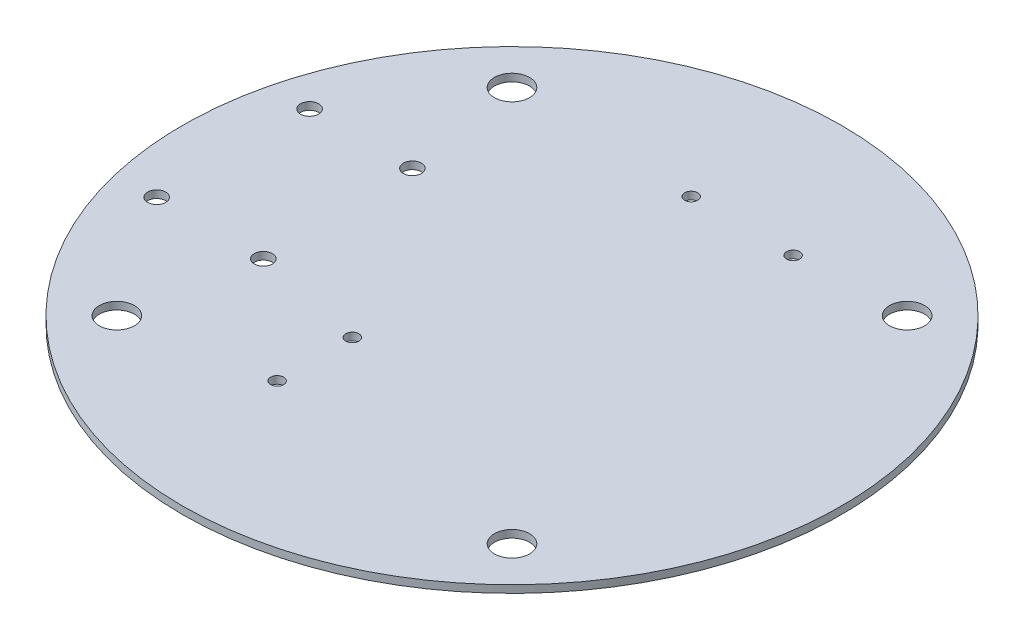
from build123d import *

# Parameters (mm, degrees)
SKETCH1_R            = 65.7
BOSS_EXTRUDE1_DEPTH  = 1.5
M6_CLEARANCE_HOLE1_D = 7
CIRPATTERN1_COUNT    = 4
M2_CLEARANCE_HOLE1_D = 2.6
M3_CLEARANCE_HOLE2_D = 3.6


with BuildPart() as part:
    # Sketch1 → Boss-Extrude1 (new body)
    with BuildSketch(Plane(origin=(0, 0, 0), x_dir=(1, 0, 0), z_dir=(0, 1, 0))):
        Circle(SKETCH1_R)
    extrude(amount=BOSS_EXTRUDE1_DEPTH)

    # M6 Clearance Hole1 (through all)
    with Locations(Plane(origin=(0, 1.5, 0), x_dir=(1, 0, 0), z_dir=(0, 1, 0))):
        with Locations((-39.385847712, -39.385847712)):
            m6_clearance_hole1 = Hole(M6_CLEARANCE_HOLE1_D / 2)

    # CirPattern1: M6 Clearance Hole1 ×4 about axis
    cirpattern1_axis = Axis((0, 1.5, 0), (0, -1, 0))
    for i in range(1, CIRPATTERN1_COUNT):
        add(m6_clearance_hole1.rotate(cirpattern1_axis, i * 360 / CIRPATTERN1_COUNT), mode=Mode.SUBTRACT)

    # M2 Clearance Hole1 (through all)
    with Locations(Plane(origin=(0, 1.5, 0), x_dir=(1, 0, 0), z_dir=(0, 1, 0))):
        with Locations((-2.709999951, 38.430000111), (17.610000128, 38.430000136), (-12.154, -19.673715678), (-12.154, -34.673715678)):
            Hole(M2_CLEARANCE_HOLE1_D / 2)

    # M3 Clearance Hole2 (through all)
    with Locations(Plane(origin=(0, 1.5, 0), x_dir=(1, 0, 0), z_dir=(0, 1, 0))):
        with Locations((-55.86454119, 15.511690642), (-55.864546519, -14.968309358), (-34.604546519, -14.968313075), (-35.36654119, 15.511687058)):
            Hole(M3_CLEARANCE_HOLE2_D / 2)


solid = part.part
